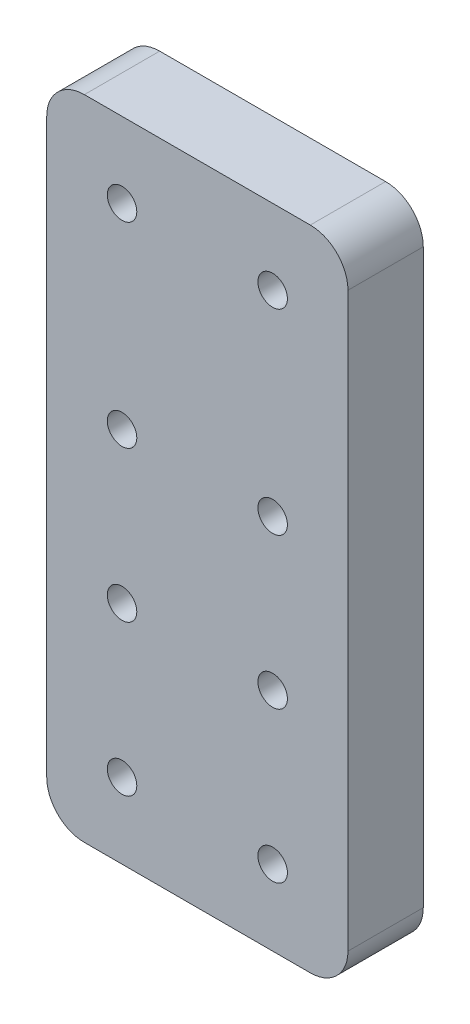
from build123d import *

# Parameters (mm, degrees)
SKETCH2_W           = 50.8
SKETCH2_H           = 109.22
BOSS_EXTRUDE1_DEPTH = 12.7
SKETCH3_R           = 2.4892
CUT_EXTRUDE1_DEPTH  = 122.123649218
FILLET1_R           = 6.35


with BuildPart() as part:
    # Sketch2 → Boss-Extrude1 (new body)
    with BuildSketch(Plane.XY):
        with Locations((25.4, 54.61)):
            Rectangle(SKETCH2_W, SKETCH2_H)
    extrude(amount=-BOSS_EXTRUDE1_DEPTH)

    # Sketch3 → Cut-Extrude1 (cut, through all)
    with BuildSketch(Plane.XY):
        with Locations((12.7, 96.52)):
            Circle(SKETCH3_R)
        with Locations((38.1, 96.52)):
            Circle(SKETCH3_R)
        with Locations((12.7, 63.5)):
            Circle(SKETCH3_R)
        with Locations((12.7, 38.1)):
            Circle(SKETCH3_R)
        with Locations((12.7, 12.7)):
            Circle(SKETCH3_R)
        with Locations((12.7, -12.7)):
            Circle(SKETCH3_R)
        with Locations((12.7, -38.1)):
            Circle(SKETCH3_R)
        with Locations((38.1, 38.1)):
            Circle(SKETCH3_R)
        with Locations((38.1, 12.7)):
            Circle(SKETCH3_R)
        with Locations((38.1, -12.7)):
            Circle(SKETCH3_R)
        with Locations((38.1, -38.1)):
            Circle(SKETCH3_R)
        with Locations((38.1, 63.5)):
            Circle(SKETCH3_R)
    extrude(amount=-CUT_EXTRUDE1_DEPTH, mode=Mode.SUBTRACT)

    # Fillet1
    fillet1_edges = [part.edges().sort_by_distance(p)[0] for p in [
        (0, 0, -6.35),
        (50.8, 0, -6.35),
        (50.8, 109.22, -6.35),
        (0, 109.22, -6.35),
    ]]
    fillet(fillet1_edges, radius=FILLET1_R)


solid = part.part
